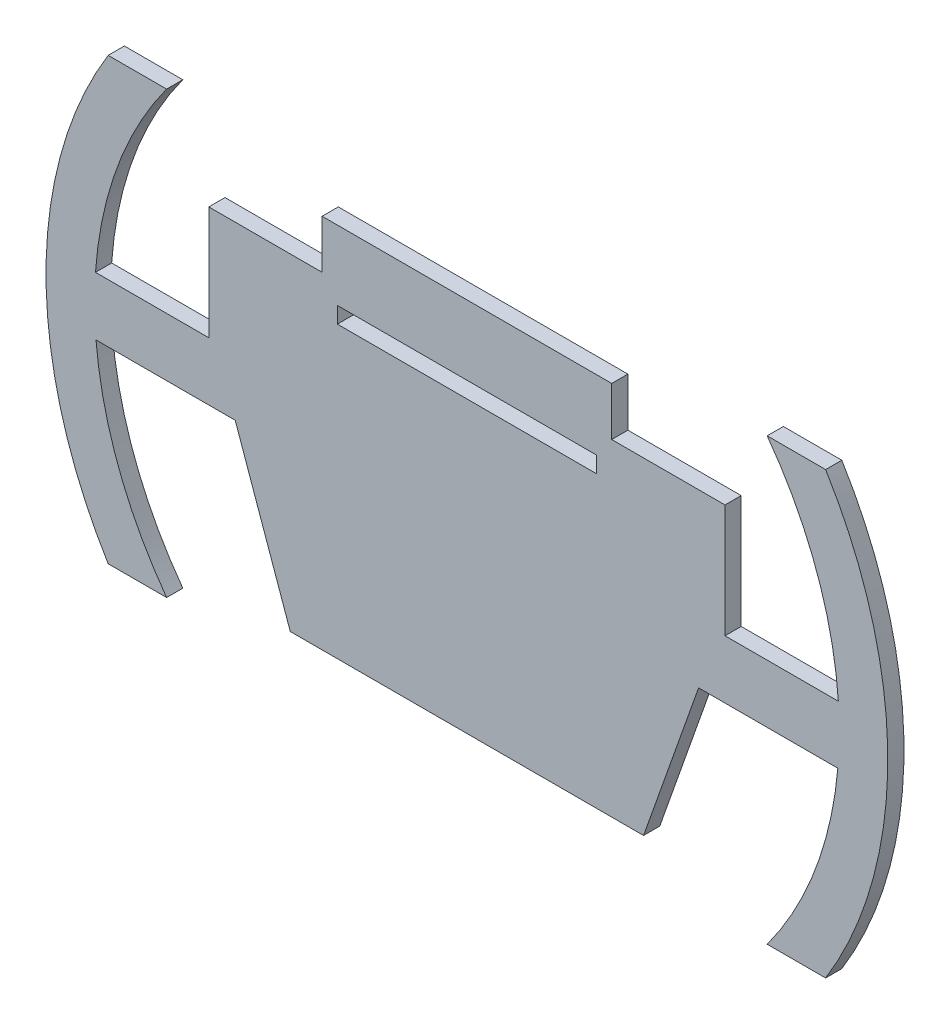
from build123d import *

# Parameters (mm, degrees)
BOSS_EXTRU_1_DEPTH      = 5
ESQUISSE2_W             = 80
ESQUISSE2_H             = 5
ENL_V_MAT_EXTRU_1_DEPTH = 10


with BuildPart() as part:
    # Esquisse1 → Boss.-Extru.1 (new body)
    with BuildSketch(Plane.XY):
        with BuildLine():
            Line((-79.721401665, 25), (-79.721401665, -10))
            Line((-79.721401665, -10), (-114.721401665, -10))
            ThreePointArc((-114.721401665, -10), (-107.982507013, 21.557277197), (-92.741576437, 50))
            Line((-92.741576437, 50), (-110.797111876, 50))
            ThreePointArc((-110.797111876, 50), (-130, -18), (-110.797111876, -86))
            Line((-110.797111876, -86), (-92.741576437, -86))
            ThreePointArc((-92.741576437, -86), (-107.633364605, -58.497639732), (-114.564392374, -28))
            Line((-114.564392374, -28), (-71.564392374, -28))
            Line((-71.564392374, -28), (-54.56, -76))
            Line((-54.56, -76), (54.56, -76))
            Line((54.56, -76), (71.564392374, -28))
            Line((71.564392374, -28), (114.564392374, -28))
            ThreePointArc((114.564392374, -28), (107.633364605, -58.497639732), (92.741576437, -86))
            Line((92.741576437, -86), (110.797111876, -86))
            ThreePointArc((110.797111876, -86), (130, -18), (110.797111876, 50))
            Line((110.797111876, 50), (92.741576437, 50))
            ThreePointArc((92.741576437, 50), (107.982507013, 21.557277197), (114.721401665, -10))
            Line((114.721401665, -10), (79.721401665, -10))
            Line((79.721401665, -10), (79.721401665, 25))
            Line((79.721401665, 25), (44.721401665, 25))
            Line((44.721401665, 25), (44.721401665, 40))
            Line((44.721401665, 40), (-44.721401665, 40))
            Line((-44.721401665, 40), (-44.721401665, 25))
            Line((-44.721401665, 25), (-79.721401665, 25))
        make_face()
    extrude(amount=BOSS_EXTRU_1_DEPTH)

    # Esquisse2 → Enlèv. mat.-Extru.1 (cut)
    with BuildSketch(Plane.XY.offset(5)):
        with Locations((0, 16)):
            Rectangle(ESQUISSE2_W, ESQUISSE2_H)
    extrude(amount=-ENL_V_MAT_EXTRU_1_DEPTH, mode=Mode.SUBTRACT)


solid = part.part
